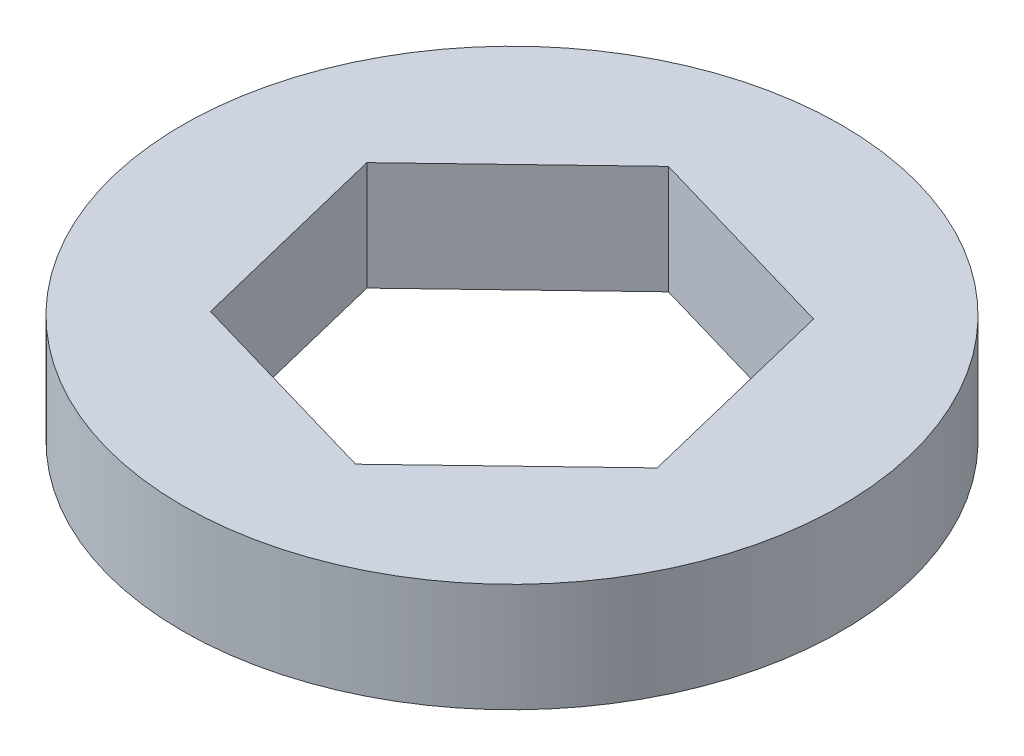
from build123d import *

# Parameters (mm, degrees)
SKETCH1_R           = 4.55
BOSS_EXTRUDE1_DEPTH = 1.5
CUT_EXTRUDE1_DEPTH  = 15


with BuildPart() as part:
    # Sketch1 → Boss-Extrude1 (new body)
    with BuildSketch(Plane(origin=(0, 0, 0), x_dir=(1, 0, 0), z_dir=(0, 1, 0))):
        Circle(SKETCH1_R)
    extrude(amount=BOSS_EXTRUDE1_DEPTH)

    # Sketch2 → Cut-Extrude1 (cut)
    with BuildSketch(Plane(origin=(0, 1.5, 0), x_dir=(1, 0, 0), z_dir=(0, 1, 0))):
        Polygon((-2.126350259, -2.036819721), (0.700762492, -2.859883202), (2.827112751, -0.823063481), (2.126350259, 2.036819721), (-0.700762492, 2.859883202), (-2.827112751, 0.823063481), align=None)
    extrude(amount=-CUT_EXTRUDE1_DEPTH, mode=Mode.SUBTRACT)


solid = part.part
